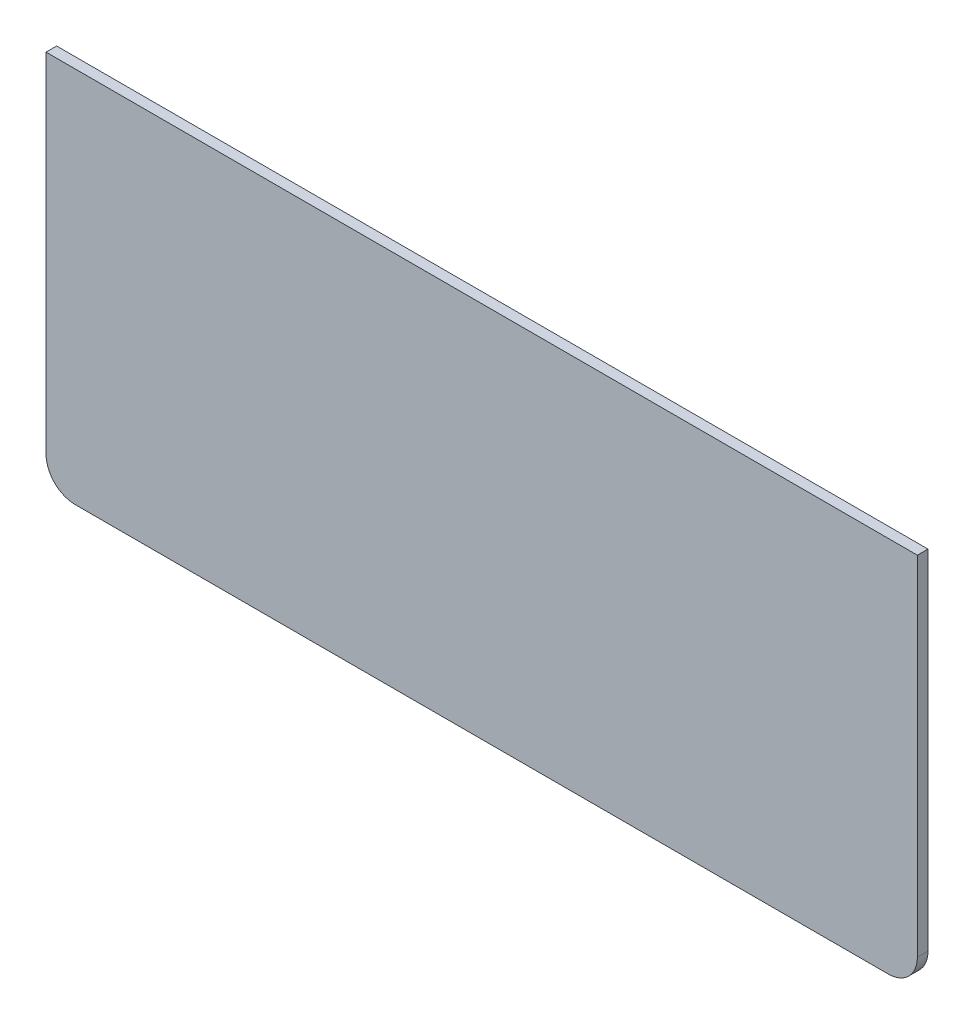
from build123d import *

# Parameters (mm, degrees)
SKETCH2_W           = 261.35
SKETCH2_H           = 113.175
BOSS_EXTRUDE1_DEPTH = 3.175
FILLET1_R           = 8.73125


with BuildPart() as part:
    # Sketch2 → Boss-Extrude1 (new body)
    with BuildSketch(Plane.XY):
        with Locations((77.088397155, -16.051971223)):
            Rectangle(SKETCH2_W, SKETCH2_H)
    extrude(amount=BOSS_EXTRUDE1_DEPTH)

    # Fillet1
    fillet1_edges = [part.edges().sort_by_distance(p)[0] for p in [
        (-53.586602845, -72.639471223, 1.5875),
        (207.763397155, -72.639471223, 1.5875),
    ]]
    fillet(fillet1_edges, radius=FILLET1_R)


solid = part.part
